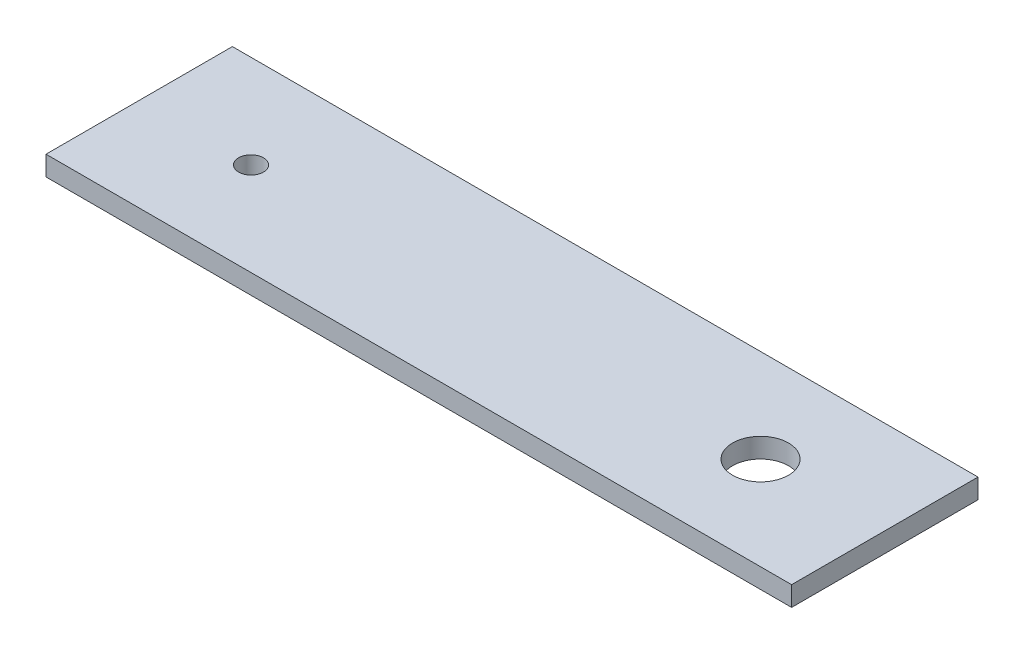
from build123d import *

# Parameters (mm, degrees)
SKETCH1_W           = 120
SKETCH1_H           = 30
BOSS_EXTRUDE1_DEPTH = 3.175
SKETCH2_R           = 2
SKETCH2_R_2         = 4.5
CUT_EXTRUDE1_DEPTH  = 3.175


with BuildPart() as part:
    # Sketch1 → Boss-Extrude1 (new body)
    with BuildSketch(Plane(origin=(0, 0, 0), x_dir=(1, 0, 0), z_dir=(0, 1, 0))):
        with Locations((60, 15)):
            Rectangle(SKETCH1_W, SKETCH1_H)
    extrude(amount=BOSS_EXTRUDE1_DEPTH)

    # Sketch2 → Cut-Extrude1 (cut)
    with BuildSketch(Plane(origin=(0, 3.175, 0), x_dir=(1, 0, 0), z_dir=(0, 1, 0))):
        with Locations((18, 15)):
            Circle(SKETCH2_R)
        with Locations((100, 15)):
            Circle(SKETCH2_R_2)
    extrude(amount=-CUT_EXTRUDE1_DEPTH, mode=Mode.SUBTRACT)


solid = part.part
